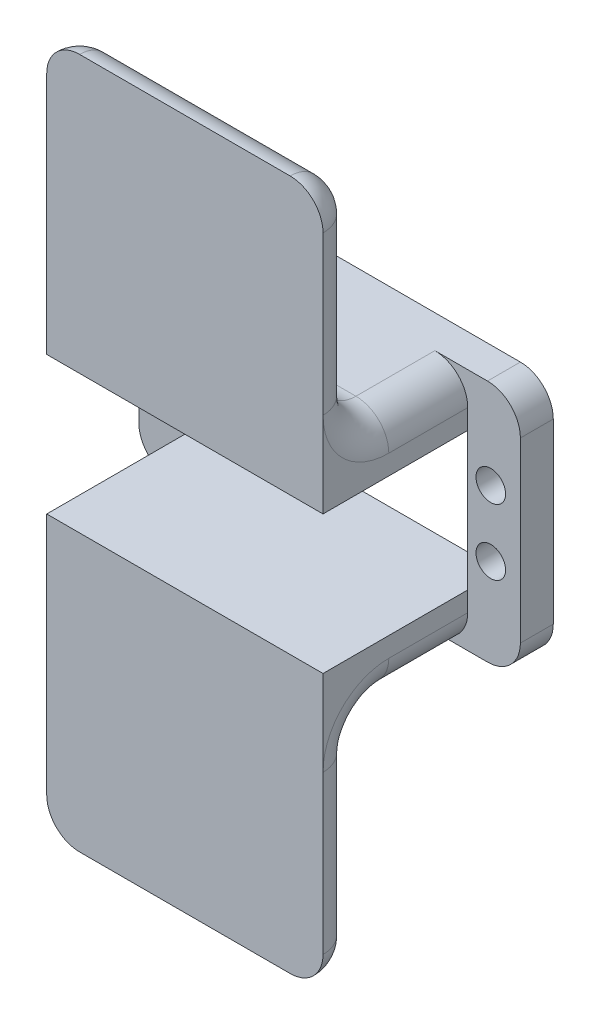
from build123d import *

# Parameters (mm, degrees)
SKETCH1_W           = 58
SKETCH1_H           = 37
SKETCH1_R           = 2.25
SKETCH1_W_2         = 42
SKETCH1_H_2         = 21
BOSS_EXTRUDE1_DEPTH = 5
SKETCH2_W           = 42
SKETCH2_H           = 8
BOSS_EXTRUDE2_DEPTH = 17
SKETCH3_W           = 42
SKETCH3_H           = 42
BOSS_EXTRUDE3_DEPTH = 5
FILLET1_R           = 5
FILLET2_R           = 5
FILLET3_R           = 5
FILLET4_R           = 5
FILLET5_R           = 5
FILLET6_R           = 5
FILLET7_R           = 5


with BuildPart() as part:
    # Sketch1 → Boss-Extrude1 (new body)
    with BuildSketch(Plane.XY):
        Rectangle(SKETCH1_W, SKETCH1_H)
        with Locations((-24.5, 5)):
            Circle(SKETCH1_R, mode=Mode.SUBTRACT)
        with Locations((-24.5, -5)):
            Circle(SKETCH1_R, mode=Mode.SUBTRACT)
        with Locations(Location((24.5, 5, 0), (0, 0, 180))):
            Circle(SKETCH1_R, mode=Mode.SUBTRACT)
        with Locations(Location((24.5, -5, 0), (0, 0, 180))):
            Circle(SKETCH1_R, mode=Mode.SUBTRACT)
        Rectangle(SKETCH1_W_2, SKETCH1_H_2, mode=Mode.SUBTRACT)
    extrude(amount=BOSS_EXTRUDE1_DEPTH)

    # Sketch2 → Boss-Extrude2 (add)
    with BuildSketch(Plane.XY.offset(5)):
        with Locations((0, 14.5)):
            Rectangle(SKETCH2_W, SKETCH2_H)
        with Locations((0, -14.5)):
            Rectangle(SKETCH2_W, SKETCH2_H)
    extrude(amount=BOSS_EXTRUDE2_DEPTH)

    # Sketch3 → Boss-Extrude3 (add)
    with BuildSketch(Plane.XY.offset(22)):
        with Locations((0, -31.5)):
            Rectangle(SKETCH3_W, SKETCH3_H)
        with Locations((0, 31.5)):
            Rectangle(SKETCH3_W, SKETCH3_H)
    extrude(amount=BOSS_EXTRUDE3_DEPTH)

    # Fillet1
    fillet1_edges = [part.edges().sort_by_distance(p)[0] for p in [
        (0, 18.5, 22),
    ]]
    fillet(fillet1_edges, radius=FILLET1_R)

    # Fillet2
    fillet2_edges = [part.edges().sort_by_distance(p)[0] for p in [
        (0, -18.5, 22),
    ]]
    fillet(fillet2_edges, radius=FILLET2_R)

    # Fillet3
    fillet3_edges = [part.edges().sort_by_distance(p)[0] for p in [
        (0, 52.5, 22),
    ]]
    fillet(fillet3_edges, radius=FILLET3_R - 0.0001)  # a hair under: the kernel refuses the full size

    # Fillet4
    fillet4_edges = [part.edges().sort_by_distance(p)[0] for p in [
        (0, -52.5, 22),
    ]]
    fillet(fillet4_edges, radius=FILLET4_R - 0.0001)  # a hair under: the kernel refuses the full size

    # Fillet5
    fillet5_edges = [part.edges().sort_by_distance(p)[0] for p in [
        (-21, 51.035563195, 23.464436805),
        (-21, 18.5, 11),
        (-21, 19.964466094, 20.535533906),
        (21, 18.5, 11),
        (21, 19.964466094, 20.535533906),
        (21, 51.035563195, 23.464436805),
        (-21, 35.50005, 22),
        (21, 35.50005, 22),
    ]]
    fillet(fillet5_edges, radius=FILLET5_R - 0.0001)  # a hair under: the kernel refuses the full size

    # Fillet6
    fillet6_edges = [part.edges().sort_by_distance(p)[0] for p in [
        (-21, -35.50005, 22),
        (21, -18.5, 11),
        (-21, -18.5, 11),
        (21, -19.964466094, 20.535533906),
        (-21, -19.964466094, 20.535533906),
        (21, -35.50005, 22),
        (21, -51.035563195, 23.464436805),
        (-21, -51.035563195, 23.464436805),
    ]]
    fillet(fillet6_edges, radius=FILLET6_R - 0.0001)  # a hair under: the kernel refuses the full size

    # Fillet7
    fillet7_edges = [part.edges().sort_by_distance(p)[0] for p in [
        (-29, 18.5, 2.5),
        (-29, -18.5, 2.5),
        (29, -18.5, 2.5),
        (29, 18.5, 2.5),
    ]]
    fillet(fillet7_edges, radius=FILLET7_R)


solid = part.part
